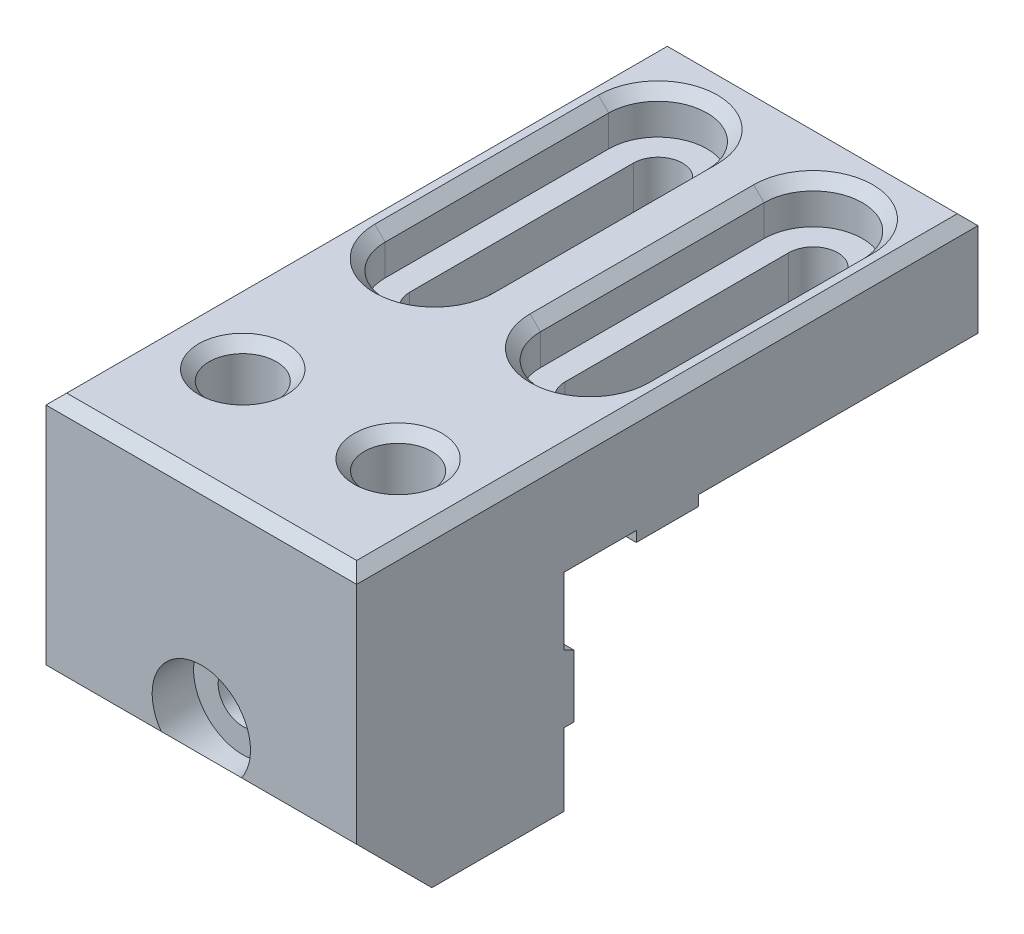
from build123d import *
from OCP.BRepFilletAPI import BRepFilletAPI_MakeChamfer

# Parameters (mm, degrees)
RESSALTO_EXTRUS_O1_DEPTH = 30
CORTE_EXTRUS_O1_REACH    = 61.169
ESBO_O2_R                = 3.25
CORTE_EXTRUS_O3_START    = 8.755336939
CORTE_EXTRUS_O3_DEPTH    = 4
CORTE_EXTRUS_O2_REACH    = 71.263
ESBO_O3_R                = 2.375
ESBO_O3_3_R              = 2.375
CORTE_EXTRUS_O4_DEPTH    = 4
ESBO_O4_W                = 6
ESBO_O4_H                = 6
ESBO_O4_W_2              = 3
RESSALTO_EXTRUS_O2_DEPTH = 1
ESBO_O5_R                = 6.5
CORTE_EXTRUS_O5_DEPTH    = 55.781368683
CHANFRO1_SIZE            = 1
ESBO_O6_W                = 10
ESBO_O6_H                = 6
RESSALTO_EXTRUS_O3_DEPTH = 1
CHANFRO2_SIZE            = 0.5
CHANFRO2_SIZE_2          = 1


# Read off the part's stored shape, not the designer's step: Corte-extrusão3
with BuildPart() as part:
    # Esboço1 → Ressalto-extrusão1 (new body)
    with BuildSketch(Plane(origin=(0, 0, 0), x_dir=(0, 0, -1), z_dir=(1, 0, 0))):
        Polygon((1.243161309, 2.755336939), (41.243161309, 2.755336939), (41.243161309, 12.755336939), (-18.756838691, 12.755336939), (-18.756838691, -9.981327227), (-11.493502857, -17.244663061), (1.243161309, -17.244663061), align=None)
    extrude(amount=RESSALTO_EXTRUS_O1_DEPTH)

    # Esboço2 → Corte-extrusão1 (cut, up to next)
    with BuildSketch(Plane(origin=(0, 12.755336939, 0), x_dir=(1, 0, 0), z_dir=(0, 1, 0)), mode=Mode.PRIVATE) as corte_extrus_o1_sk1:
        with BuildLine():
            Line((5.125, 32.834447928), (5.125, 11.243161309))
            ThreePointArc((5.125, 11.243161309), (7.5, 8.868161309), (9.875, 11.243161309))
            Line((9.875, 11.243161309), (9.875, 32.834447928))
            ThreePointArc((9.875, 32.834447928), (7.5, 35.209447928), (5.125, 32.834447928))
        make_face()
    corte_extrus_o1_tool1 = extrude(corte_extrus_o1_sk1.sketch, amount=-CORTE_EXTRUS_O1_REACH, mode=Mode.PRIVATE) & part.part
    # Esboço2 → Corte-extrusão1 (cut, up to next)
    with BuildSketch(Plane(origin=(0, 12.755336939, 0), x_dir=(1, 0, 0), z_dir=(0, 1, 0)), mode=Mode.PRIVATE) as corte_extrus_o1_sk2:
        with BuildLine():
            Line((20.125, 32.834447928), (20.125, 11.243161309))
            ThreePointArc((20.125, 11.243161309), (22.5, 8.868161309), (24.875, 11.243161309))
            Line((24.875, 11.243161309), (24.875, 32.834447928))
            ThreePointArc((24.875, 32.834447928), (22.5, 35.209447928), (20.125, 32.834447928))
        make_face()
    corte_extrus_o1_tool2 = extrude(corte_extrus_o1_sk2.sketch, amount=-CORTE_EXTRUS_O1_REACH, mode=Mode.PRIVATE) & part.part
    # Esboço2 → Corte-extrusão1 (cut, up to next)
    with BuildSketch(Plane(origin=(0, 12.755336939, 0), x_dir=(1, 0, 0), z_dir=(0, 1, 0)), mode=Mode.PRIVATE) as corte_extrus_o1_sk3:
        with Locations(Location((7.5, -7.256838691, 0), (0, 0, 270))):
            Circle(ESBO_O2_R)
    corte_extrus_o1_tool3 = extrude(corte_extrus_o1_sk3.sketch, amount=-CORTE_EXTRUS_O1_REACH, mode=Mode.PRIVATE) & part.part
    # Esboço2 → Corte-extrusão1 (cut, up to next)
    with BuildSketch(Plane(origin=(0, 12.755336939, 0), x_dir=(1, 0, 0), z_dir=(0, 1, 0)), mode=Mode.PRIVATE) as corte_extrus_o1_sk4:
        with Locations(Location((22.5, -7.256838691, 0), (0, 0, 270))):
            Circle(ESBO_O2_R)
    corte_extrus_o1_tool4 = extrude(corte_extrus_o1_sk4.sketch, amount=-CORTE_EXTRUS_O1_REACH, mode=Mode.PRIVATE) & part.part
    add(corte_extrus_o1_tool1.solids().sort_by_distance((7.5, 12.755337, -22.038805))[0], mode=Mode.SUBTRACT)
    add(corte_extrus_o1_tool2.solids().sort_by_distance((22.5, 12.755337, -22.038805))[0], mode=Mode.SUBTRACT)
    add(corte_extrus_o1_tool3.solids().sort_by_distance((7.5, 12.755337, 7.256839))[0], mode=Mode.SUBTRACT)
    add(corte_extrus_o1_tool4.solids().sort_by_distance((22.5, 12.755337, 7.256839))[0], mode=Mode.SUBTRACT)

    # Corte-extrusão3 outline → Corte-extrusão3 (cut)
    # profile 1 of 2: a face of its own
    with BuildSketch(Plane(origin=(0, 0, 0), x_dir=(1, 0, 0), z_dir=(0, 1, 0)).offset(CORTE_EXTRUS_O3_START)):
        with BuildLine():
            ThreePointArc((2.75, 11.243161309), (7.5, 6.493161309), (12.25, 11.243161309))
            Line((12.25, 11.243161309), (12.25, 32.834447928))
            ThreePointArc((12.25, 32.834447928), (7.5, 37.584447928), (2.75, 32.834447928))
            Line((2.75, 32.834447928), (2.75, 11.243161309))
        make_face()
        with BuildLine():
            ThreePointArc((5.125, 32.834447928), (7.5, 35.209447928), (9.875, 32.834447928))
            Line((9.875, 32.834447928), (9.875, 11.243161309))
            ThreePointArc((9.875, 11.243161309), (7.5, 8.868161309), (5.125, 11.243161309))
            Line((5.125, 11.243161309), (5.125, 32.834447928))
        make_face(mode=Mode.SUBTRACT)
    # profile 2 of 2: a face of its own
    with BuildSketch(Plane(origin=(0, 0, 0), x_dir=(1, 0, 0), z_dir=(0, 1, 0)).offset(CORTE_EXTRUS_O3_START)):
        with BuildLine():
            ThreePointArc((17.75, 11.243161309), (22.5, 6.493161309), (27.25, 11.243161309))
            Line((27.25, 11.243161309), (27.25, 32.834447928))
            ThreePointArc((27.25, 32.834447928), (22.5, 37.584447928), (17.75, 32.834447928))
            Line((17.75, 32.834447928), (17.75, 11.243161309))
        make_face()
        with BuildLine():
            Line((20.125, 11.243161309), (20.125, 32.834447928))
            ThreePointArc((20.125, 32.834447928), (22.5, 35.209447928), (24.875, 32.834447928))
            Line((24.875, 32.834447928), (24.875, 11.243161309))
            ThreePointArc((24.875, 11.243161309), (22.5, 8.868161309), (20.125, 11.243161309))
        make_face(mode=Mode.SUBTRACT)
    extrude(amount=CORTE_EXTRUS_O3_DEPTH, mode=Mode.SUBTRACT)

    # Esboço3 → Corte-extrusão2 (cut, up to next)
    with BuildSketch(Plane.XY.offset(18.756838691), mode=Mode.PRIVATE) as corte_extrus_o2_sk1:
        with Locations((15, -7.244663061)):
            Circle(ESBO_O3_R)
    corte_extrus_o2_tool1 = extrude(corte_extrus_o2_sk1.sketch, amount=-CORTE_EXTRUS_O2_REACH, mode=Mode.PRIVATE) & part.part
    add(corte_extrus_o2_tool1.solids().sort_by_distance((15, -7.244663, 18.756839))[0], mode=Mode.SUBTRACT)

    # Esboço3<3> → Corte-extrusão4 (cut)
    # profile 1 of 2: a face of its own
    with BuildSketch(Plane.XY.offset(18.756838691)):
        with BuildLine():
            Line((18.882417963, -9.981327227), (11.117582037, -9.981327227))
            ThreePointArc((11.117582037, -9.981327227), (15, -11.994663061), (18.882417963, -9.981327227))
        make_face()
    # profile 2 of 2: a face of its own
    with BuildSketch(Plane.XY.offset(18.756838691)):
        with BuildLine():
            ThreePointArc((18.882417963, -9.981327227), (19.527912617, -8.680109799), (19.75, -7.244663061))
            ThreePointArc((19.75, -7.244663061), (13.564553262, -2.716750444), (11.117582037, -9.981327227))
            Line((11.117582037, -9.981327227), (18.882417963, -9.981327227))
        make_face()
        with Locations((15, -7.244663061)):
            Circle(ESBO_O3_3_R, mode=Mode.SUBTRACT)
    extrude(amount=-CORTE_EXTRUS_O4_DEPTH, mode=Mode.SUBTRACT)

    # Esboço4 → Ressalto-extrusão2 (add)
    with BuildSketch(Plane.XZ.offset(-2.755336939)):
        with Locations((15, -11.243161309)):
            Rectangle(ESBO_O4_W, ESBO_O4_H)
        with Locations((1.5, -11.243161309)):
            Rectangle(ESBO_O4_W_2, ESBO_O4_H)
        with Locations((28.5, -11.243161309)):
            Rectangle(ESBO_O4_W_2, ESBO_O4_H)
    extrude(amount=RESSALTO_EXTRUS_O2_DEPTH)

    # Esboço5 → Corte-extrusão5 (cut, through all)
    with BuildSketch(Plane.XZ.offset(-2.755336939)):
        with Locations(Location((7.5, 7.256838691, 0), (0, 0, 40.677035539))):
            Circle(ESBO_O5_R)
        with Locations(Location((22.5, 7.256838691, 0), (0, 0, 40.677035539))):
            Circle(ESBO_O5_R)
    extrude(amount=CORTE_EXTRUS_O5_DEPTH, mode=Mode.SUBTRACT)

    # Chanfro1
    chanfro1_edges = [part.edges().sort_by_distance(p)[0] for p in [
        (27.25, 12.755336939, -22.038804619),
        (22.5, 12.755336939, -37.584447928),
        (17.75, 12.755336939, -22.038804619),
        (22.5, 12.755336939, -6.493161309),
        (15, 12.755336939, 18.756838691),
        (15, 12.755336939, -41.243161309),
        (30, 12.755336939, -11.243161309),
        (7.5, 12.755336939, 4.006838691),
        (22.5, 12.755336939, 4.006838691),
        (12.25, 12.755336939, -22.038804619),
        (7.5, 12.755336939, -37.584447928),
        (2.75, 12.755336939, -22.038804619),
        (7.5, 12.755336939, -6.493161309),
        (0, 12.755336939, -11.243161309),
    ]]
    chamfer(chanfro1_edges, length=CHANFRO1_SIZE)

    # Esboço6 → Ressalto-extrusão3 (add)
    with BuildSketch(Plane(origin=(0, 0, -1.243161309), x_dir=(-1, 0, 0), z_dir=(0, 0, -1))):
        with Locations((-25, -7.244663061)):
            Rectangle(ESBO_O6_W, ESBO_O6_H)
        with Locations((-5, -7.244663061)):
            Rectangle(ESBO_O6_W, ESBO_O6_H)
    extrude(amount=RESSALTO_EXTRUS_O3_DEPTH)

    # Chanfro2
    chanfro2_edges_1 = [part.edges().sort_by_distance(p)[0] for p in [
        (25, -4.244663061, -1.243161309),
    ]]
    chanfro2_side_1 = [part.faces().sort_by_distance(p)[0] for p in [
        (25, -4.234663061, -1.243161309),
    ]]
    chanfro2_edges_2 = [part.edges().sort_by_distance(p)[0] for p in [
        (5, -4.244663061, -1.243161309),
    ]]
    chanfro2_side_2 = [part.faces().sort_by_distance(p)[0] for p in [
        (5, -4.234663061, -1.243161309),
    ]]
    chanfro2 = BRepFilletAPI_MakeChamfer(part.part.solid().wrapped)
    for e in chanfro2_edges_1:
        chanfro2.Add(CHANFRO2_SIZE - 0.0001, CHANFRO2_SIZE_2 - 0.0001, e.wrapped, chanfro2_side_1[0].wrapped)
    for e in chanfro2_edges_2:
        chanfro2.Add(CHANFRO2_SIZE - 0.0001, CHANFRO2_SIZE_2 - 0.0001, e.wrapped, chanfro2_side_2[0].wrapped)
    add(Compound.cast(chanfro2.Shape()), mode=Mode.REPLACE)  # a hair under: the kernel refuses the full size


solid = part.part
